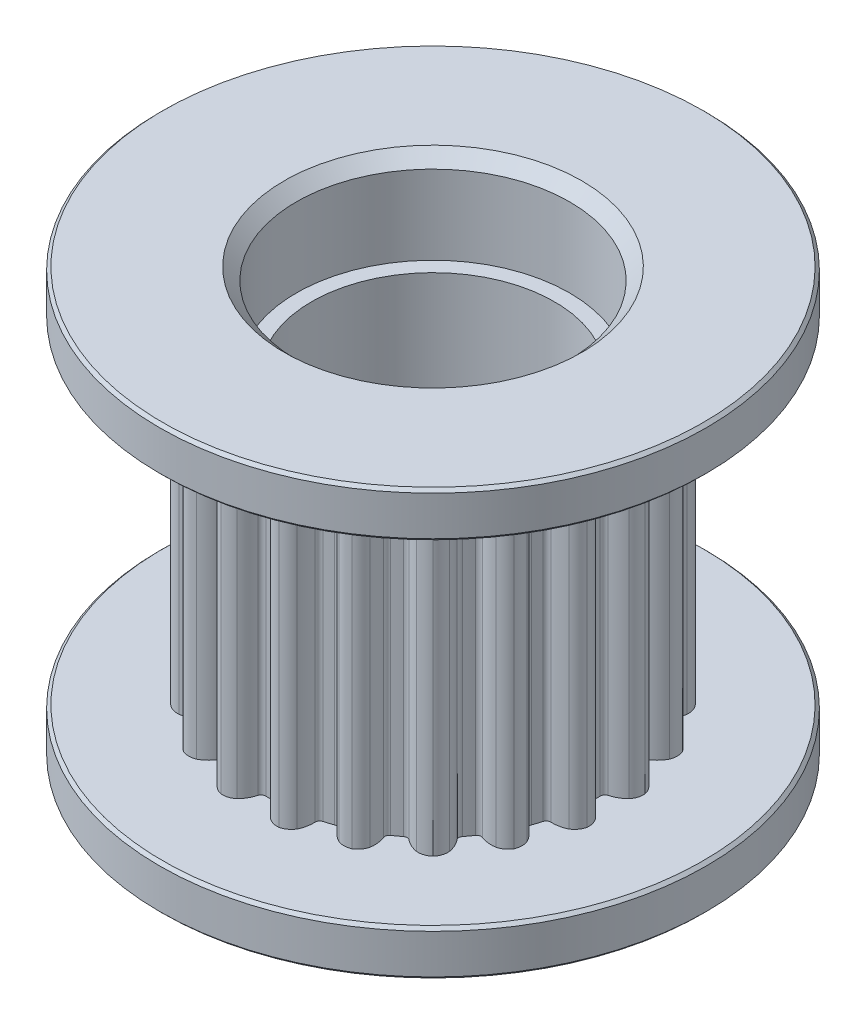
from build123d import *

# Parameters (mm, degrees)
GT2_PROFILE_REACH                 = 16.526
GT2_PROFILE_DIRECTION_2_REACH     = 16.526
GT2_GROOVE_CIRCULAR_PATTERN_COUNT = 20
INNER_CHAMFER_SIZE                = 0.4
OUTER_CHAMFER_SIZE                = 0.1


with BuildPart() as part:
    # Body Sketch → Body (revolve)
    with BuildSketch(Plane.XY):
        Polygon((6.11, -5.5), (6.11, 5.5), (9, 5.5), (9, 7), (4.5, 7), (4.5, 4), (4, 4), (4, -4), (4.5, -4), (4.5, -7), (9, -7), (9, -5.5), align=None)
    revolve(axis=Axis((0, 7, 0), (0, -1, 0)))

    # GT2 Profile: up to this face of the body (flat: up to its plane)
    gt2_profile_end = Plane(part.part.faces().sort_by_distance((-8.745441559, -5.5, 0))[0])
    # GT2 Profile Sketch → GT2 Profile (cut, up to the picked face)
    with BuildSketch(Plane(origin=(0, 0, 0), x_dir=(1, 0, 0), z_dir=(0, 1, 0)), mode=Mode.PRIVATE) as gt2_profile_sk1:
        with BuildLine():
            ThreePointArc((0.299749921, -5.468781955), (0.244461347, -5.387479579), (0.150701934, -5.357881011))
            ThreePointArc((0.150701934, -5.357881011), (0, -5.36), (-0.150701934, -5.357881011))
            ThreePointArc((-0.150701934, -5.357881011), (-0.244461347, -5.387479579), (-0.299749921, -5.468781955))
            ThreePointArc((-0.299749921, -5.468781955), (-0.396626607, -5.703924717), (-0.549685833, -5.907025885))
            ThreePointArc((-0.549685833, -5.907025885), (-0.7593874, -6.016293358), (-0.995541542, -6.028349446))
            ThreePointArc((-0.995541542, -6.028349446), (0, -6.11), (0.995541542, -6.028349446))
            ThreePointArc((0.995541542, -6.028349446), (0.7593874, -6.016293358), (0.549685833, -5.907025885))
            ThreePointArc((0.549685833, -5.907025885), (0.396626607, -5.703924717), (0.299749921, -5.468781955))
        make_face()
    gt2_profile_tool1 = split(extrude(gt2_profile_sk1.sketch, amount=-GT2_PROFILE_REACH, mode=Mode.PRIVATE), bisect_by=gt2_profile_end, keep=Keep.BOTH, mode=Mode.PRIVATE)
    gt2_profile = gt2_profile_tool1.solids().sort_by(Axis((0, 0, 5.802237), (0, -1, 0)))[0]
    add(gt2_profile, mode=Mode.SUBTRACT)

    # GT2 Profile direction 2: up to this face of the body (flat: up to its plane)
    gt2_profile_direction_2_end = Plane(part.part.faces().sort_by_distance((-6.364558441, 5.5, 0))[0])
    # GT2 Profile Sketch → GT2 Profile direction 2 (cut, up to the picked face)
    with BuildSketch(Plane(origin=(0, 0, 0), x_dir=(1, 0, 0), z_dir=(0, 1, 0)), mode=Mode.PRIVATE) as gt2_profile_direction_2_sk1:
        with BuildLine():
            ThreePointArc((0.299749921, -5.468781955), (0.244461347, -5.387479579), (0.150701934, -5.357881011))
            ThreePointArc((0.150701934, -5.357881011), (0, -5.36), (-0.150701934, -5.357881011))
            ThreePointArc((-0.150701934, -5.357881011), (-0.244461347, -5.387479579), (-0.299749921, -5.468781955))
            ThreePointArc((-0.299749921, -5.468781955), (-0.396626607, -5.703924717), (-0.549685833, -5.907025885))
            ThreePointArc((-0.549685833, -5.907025885), (-0.7593874, -6.016293358), (-0.995541542, -6.028349446))
            ThreePointArc((-0.995541542, -6.028349446), (0, -6.11), (0.995541542, -6.028349446))
            ThreePointArc((0.995541542, -6.028349446), (0.7593874, -6.016293358), (0.549685833, -5.907025885))
            ThreePointArc((0.549685833, -5.907025885), (0.396626607, -5.703924717), (0.299749921, -5.468781955))
        make_face()
    gt2_profile_direction_2_tool1 = split(extrude(gt2_profile_direction_2_sk1.sketch, amount=GT2_PROFILE_DIRECTION_2_REACH, mode=Mode.PRIVATE), bisect_by=gt2_profile_direction_2_end, keep=Keep.BOTH, mode=Mode.PRIVATE)
    gt2_profile_direction_2 = gt2_profile_direction_2_tool1.solids().sort_by(Axis((0, 0, 5.802237), (0, 1, 0)))[0]
    add(gt2_profile_direction_2, mode=Mode.SUBTRACT)

    # GT2 Groove Circular Pattern: GT2 Profile, GT2 Profile direction 2 ×20 about axis
    gt2_groove_circular_pattern_axis = Axis((0, 7, 0), (0, 1, 0))
    add([gt2_profile.rotate(gt2_groove_circular_pattern_axis, i * 360 / GT2_GROOVE_CIRCULAR_PATTERN_COUNT) for i in range(1, GT2_GROOVE_CIRCULAR_PATTERN_COUNT)], mode=Mode.SUBTRACT)
    add([gt2_profile_direction_2.rotate(gt2_groove_circular_pattern_axis, i * 360 / GT2_GROOVE_CIRCULAR_PATTERN_COUNT) for i in range(1, GT2_GROOVE_CIRCULAR_PATTERN_COUNT)], mode=Mode.SUBTRACT)

    # Inner Chamfer
    inner_chamfer_edges = [part.edges().sort_by_distance(p)[0] for p in [
        (-4.5, -7, 0),
        (-4.5, 7, 0),
    ]]
    chamfer(inner_chamfer_edges, length=INNER_CHAMFER_SIZE)

    # Outer Chamfer
    outer_chamfer_edges = [part.edges().sort_by_distance(p)[0] for p in [
        (-9, -7, 0),
        (-9, -5.5, 0),
        (-9, 5.5, 0),
        (-9, 7, 0),
    ]]
    chamfer(outer_chamfer_edges, length=OUTER_CHAMFER_SIZE)


solid = part.part
